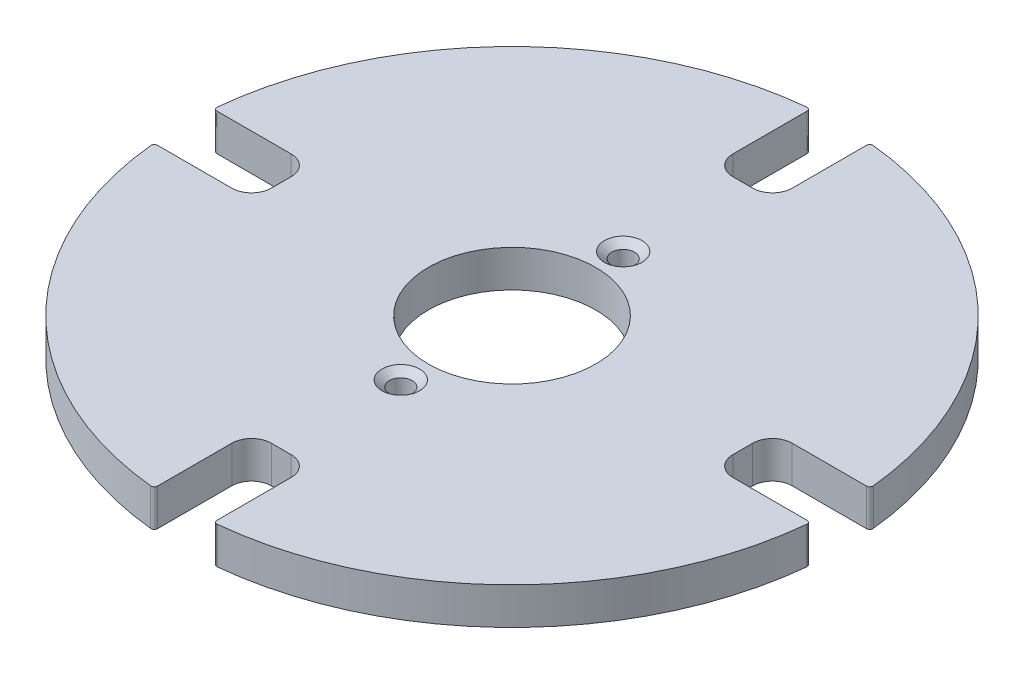
from build123d import *

# Parameters (mm, degrees)
SKETCH3_R                                         = 50
SKETCH3_R_2                                       = 12.7
BOSS_EXTRUDE4_DEPTH                               = 5.6
CUT_EXTRUDE18_DEPTH                               = 10
FILLET2_R                                         = 0.5
CSK_FOR_4_FLAT_HEAD_MACHINE_SCREW_100_D           = 3.4544
CSK_FOR_4_FLAT_HEAD_MACHINE_SCREW_100_CSINK_D     = 5.715
CSK_FOR_4_FLAT_HEAD_MACHINE_SCREW_100_CSINK_ANGLE = 100


with BuildPart() as part:
    # Sketch3 → Boss-Extrude4 (new body)
    with BuildSketch(Plane(origin=(0, 0, 0), x_dir=(1, 0, 0), z_dir=(0, 1, 0))):
        Circle(SKETCH3_R)
        Circle(SKETCH3_R_2, mode=Mode.SUBTRACT)
    extrude(amount=BOSS_EXTRUDE4_DEPTH)

    # Sketch6 → Cut-Extrude18 (cut)
    with BuildSketch(Plane(origin=(0, 0, 0), x_dir=(1, 0, 0), z_dir=(0, 1, 0))):
        with BuildLine():
            Line((-38, -4.5), (-65, -4.5))
            Line((-65, -4.5), (-65, 4.5))
            Line((-65, 4.5), (-38, 4.5))
            ThreePointArc((-38, 4.5), (-35.878679656, 3.621320344), (-35, 1.5))
            Line((-35, 1.5), (-35, -1.5))
            ThreePointArc((-35, -1.5), (-35.878679656, -3.621320344), (-38, -4.5))
        make_face()
        with BuildLine():
            Line((-4.5, 38), (-4.5, 65))
            Line((-4.5, 65), (4.5, 65))
            Line((4.5, 65), (4.5, 38))
            ThreePointArc((4.5, 38), (3.621320344, 35.878679656), (1.5, 35))
            Line((1.5, 35), (-1.5, 35))
            ThreePointArc((-1.5, 35), (-3.621320344, 35.878679656), (-4.5, 38))
        make_face()
        with BuildLine():
            Line((38, 4.5), (65, 4.5))
            Line((65, 4.5), (65, -4.5))
            Line((65, -4.5), (38, -4.5))
            ThreePointArc((38, -4.5), (35.878679656, -3.621320344), (35, -1.5))
            Line((35, -1.5), (35, 1.5))
            ThreePointArc((35, 1.5), (35.878679656, 3.621320344), (38, 4.5))
        make_face()
        with BuildLine():
            Line((4.5, -38), (4.5, -65))
            Line((4.5, -65), (-4.5, -65))
            Line((-4.5, -65), (-4.5, -38))
            ThreePointArc((-4.5, -38), (-3.621320344, -35.878679656), (-1.5, -35))
            Line((-1.5, -35), (1.5, -35))
            ThreePointArc((1.5, -35), (3.621320344, -35.878679656), (4.5, -38))
        make_face()
    extrude(amount=CUT_EXTRUDE18_DEPTH, mode=Mode.SUBTRACT)

    # Fillet2
    fillet2_edges = [part.edges().sort_by_distance(p)[0] for p in [
        (-49.797088268, 2.8, 4.5),
        (-49.797088268, 2.8, -4.5),
        (4.5, 2.8, -49.797088268),
        (-4.5, 2.8, -49.797088268),
        (49.797088268, 2.8, -4.5),
        (49.797088268, 2.8, 4.5),
        (4.5, 2.8, 49.797088268),
        (-4.5, 2.8, 49.797088268),
    ]]
    fillet(fillet2_edges, radius=FILLET2_R)

    # CSK for #4 Flat Head Machine Screw (100)1 (through all)
    with Locations(Plane(origin=(0, 5.6, 0), x_dir=(1, 0, 0), z_dir=(0, 1, 0))):
        with Locations((0, -16.862709614), (0, 16.862709614)):
            CounterSinkHole(CSK_FOR_4_FLAT_HEAD_MACHINE_SCREW_100_D / 2, CSK_FOR_4_FLAT_HEAD_MACHINE_SCREW_100_CSINK_D / 2, counter_sink_angle=CSK_FOR_4_FLAT_HEAD_MACHINE_SCREW_100_CSINK_ANGLE)


solid = part.part
